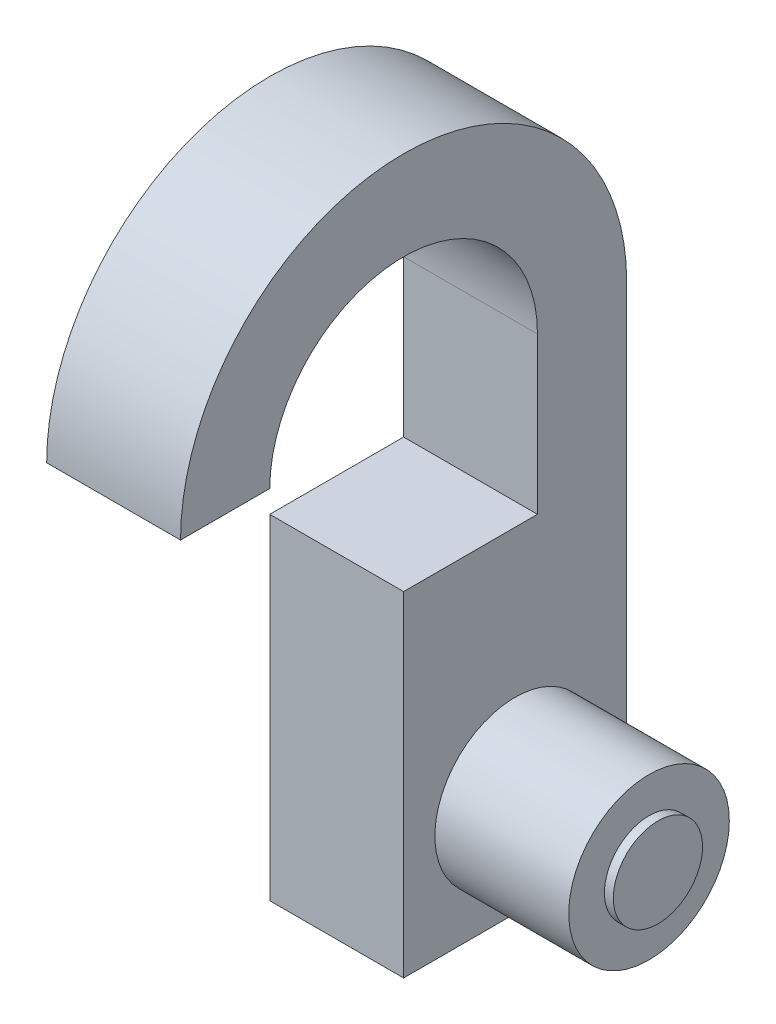
from build123d import *

# Parameters (mm, degrees)
ESBO_O1_R                = 100
RESSALTO_EXTRUS_O2_DEPTH = 620
ESBO_O1_9_R              = 180
ESBO_O1_9_R_2            = 100
RESSALTO_EXTRUS_O6_DEPTH = 600
ESBO_O1_10_R             = 180
RESSALTO_EXTRUS_O7_DEPTH = 300
ESBO_O3_W                = 300
ESBO_O3_H                = 200
RESSALTO_EXTRUS_O8_DEPTH = 350
RESSALTO_EXTRUS_O9_DEPTH = 300


with BuildPart() as part:
    # Esboço1 → Ressalto-extrusão2 (new body)
    with BuildSketch(Plane(origin=(0, 0, 0), x_dir=(0, 0, -1), z_dir=(1, 0, 0))):
        with Locations((0, -135)):
            Circle(ESBO_O1_R)
    extrude(amount=RESSALTO_EXTRUS_O2_DEPTH)

    # Esboço1<9> → Ressalto-extrusão6 (add)
    with BuildSketch(Plane(origin=(0, 0, 0), x_dir=(0, 0, -1), z_dir=(1, 0, 0))):
        with Locations((0, -135)):
            Circle(ESBO_O1_9_R)
        with Locations((0, -135)):
            Circle(ESBO_O1_9_R_2, mode=Mode.SUBTRACT)
    extrude(amount=RESSALTO_EXTRUS_O6_DEPTH)

    # Esboço1<10> → Ressalto-extrusão7 (add)
    with BuildSketch(Plane(origin=(0, 0, 0), x_dir=(0, 0, -1), z_dir=(1, 0, 0))):
        Polygon((-250, 375), (-250, -375), (250, -375), (250, 375), (50, 375), align=None)
        with Locations((0, -135)):
            Circle(ESBO_O1_10_R, mode=Mode.SUBTRACT)
    extrude(amount=RESSALTO_EXTRUS_O7_DEPTH)

    # Esboço3 → Ressalto-extrusão8 (add)
    with BuildSketch(Plane(origin=(0, 375, 0), x_dir=(1, 0, 0), z_dir=(0, 1, 0))):
        with Locations((150, 150)):
            Rectangle(ESBO_O3_W, ESBO_O3_H)
    extrude(amount=RESSALTO_EXTRUS_O8_DEPTH)

    # Esboço5 → Ressalto-extrusão9 (add)
    with BuildSketch(Plane(origin=(300, 0, 0), x_dir=(0, 0, -1), z_dir=(1, 0, 0))):
        with BuildLine():
            Line((-750, 725), (-550, 725))
            ThreePointArc((-550, 725), (-250, 1025), (50, 725))
            Line((50, 725), (250, 725))
            ThreePointArc((250, 725), (-250, 1225), (-750, 725))
        make_face()
    extrude(amount=-RESSALTO_EXTRUS_O9_DEPTH)


solid = part.part
